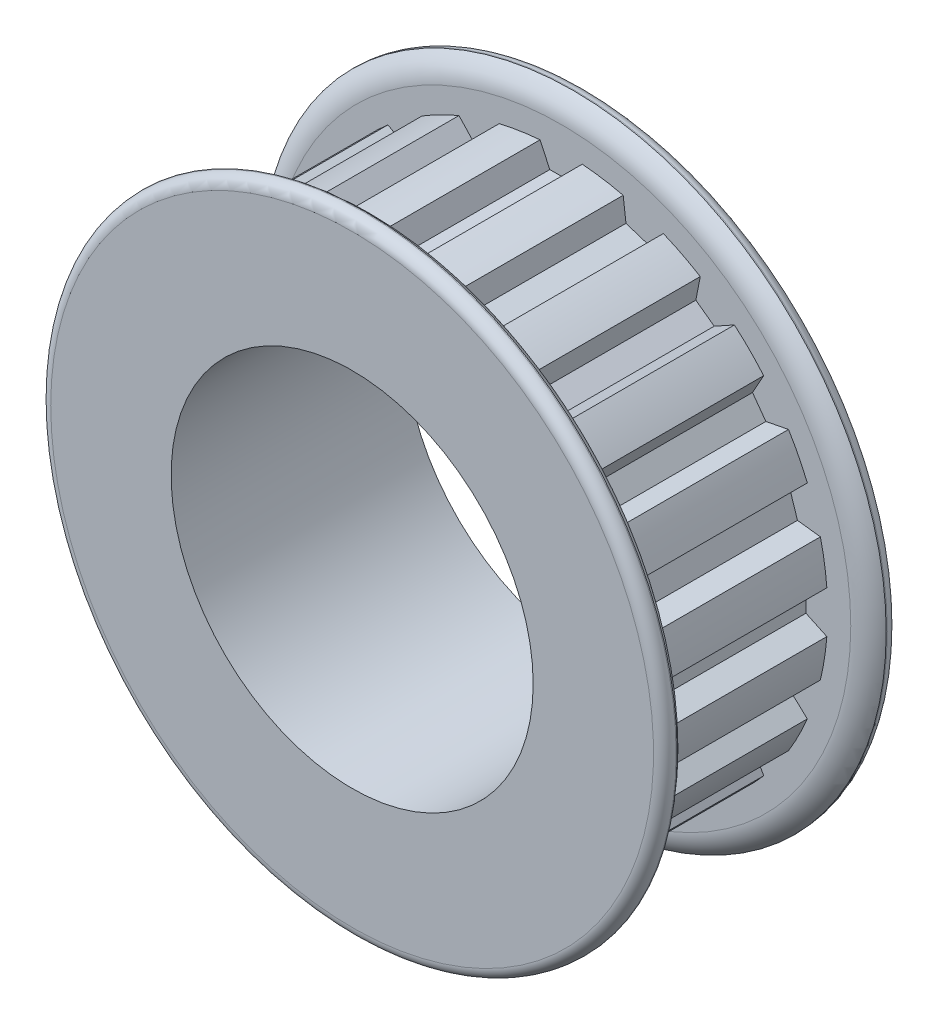
from build123d import *

# Parameters (mm, degrees)
CUT_EXTRUDE1_START     = -9.5
CUT_EXTRUDE1_DEPTH     = 11.2
CIRPATTERN1_COUNT      = 20
SKETCH4_R              = 2
CUT_EXTRUDE2_DEPTH     = 30.034462282
CUT_EXTRUDE3_DEPTH     = 1.5
CIRPATTERN2_COUNT      = 2
CIRPATTERN2_ANGLE      = 90
FILLET1_R              = 0.685714286
FILLET2_R              = 0.24
MOVE_START             = -11
MOVE_FACE1_OUTLINE_R   = 11
MOVE_FACE1_OUTLINE_R_2 = 4
MOVE_FACE1_DEPTH       = 14.2


# Read off the part's stored shape, not the designer's step: Move Face1
with BuildPart() as part:
    # Sketch7 → Revolve1 (revolve)
    with BuildSketch(Plane(origin=(0, 0, 0), x_dir=(0, 0, -1), z_dir=(1, 0, 0)), mode=Mode.PRIVATE) as revolve1_sk:
        with BuildLine():
            Line((-11, 4), (-11, 12))
            Line((-11, 12), (-3.2, 12))
            Line((-3.2, 12), (-3.2, 19))
            Line((-3.2, 19), (-2.45, 19))
            ThreePointArc((-2.45, 19), (-1.899268567, 18.392512657), (-1.7, 17.597127202))
            Line((-1.7, 17.597127202), (-1.7, 16.194254403))
            Line((-1.7, 16.194254403), (9.5, 16.194254403))
            Line((9.5, 16.194254403), (9.5, 17.597127202))
            ThreePointArc((9.5, 17.597127202), (9.699268567, 18.392512657), (10.25, 19))
            Line((10.25, 19), (11, 19))
            Line((11, 19), (11, 4))
            Line((11, 4), (-11, 4))
        make_face()
    revolve(revolve1_sk.sketch.rotate(Axis((0, 0, 11), (0, 0, -1)), 90), axis=Axis((0, 0, 11), (0, 0, -1)))

    # Sketch3 → Cut-Extrude1 (cut)
    with BuildSketch(Plane.XY.offset(CUT_EXTRUDE1_START)):
        with BuildLine():
            Line((-0.690489274, 14.873375), (0.690489274, 14.873375))
            Line((0.690489274, 14.873375), (1.2827, 16.143375))
            ThreePointArc((1.2827, 16.143375), (0, 16.194254403), (-1.2827, 16.143375))
            Line((-1.2827, 16.143375), (-0.690489274, 14.873375))
        make_face()
    cut_extrude1 = extrude(amount=CUT_EXTRUDE1_DEPTH, mode=Mode.SUBTRACT)

    # CirPattern1: Cut-Extrude1 ×20 about axis
    cirpattern1_axis = Axis((0, 0, 0), (0, 0, 1))
    for i in range(1, CIRPATTERN1_COUNT):
        add(cut_extrude1.rotate(cirpattern1_axis, i * 360 / CIRPATTERN1_COUNT), mode=Mode.SUBTRACT)

    # Sketch4 → Cut-Extrude2 (cut, through all)
    with BuildSketch(Plane(origin=(0, 0, 0), x_dir=(1, 0, 0), z_dir=(0, 1, 0))):
        with Locations(Location((0, -7.1, 0), (0, 0, 90))):
            Circle(SKETCH4_R)
    cut_extrude2 = extrude(amount=CUT_EXTRUDE2_DEPTH, mode=Mode.SUBTRACT)

    # Sketch5 → Revolve2 (revolve)
    with BuildSketch(Plane.XY.offset(7.1), mode=Mode.PRIVATE) as revolve2_sk:
        Polygon((0, 11.832159566), (0, 4), (-1.365, 4), (-2, 4.635), (-2, 11.197159566), (-1.365, 11.832159566), align=None)
    revolve2 = revolve(revolve2_sk.sketch.rotate(Axis((0, 0, 7.1), (0, 1, 0)), 270), axis=Axis((0, 0, 7.1), (0, 1, 0)))

    # Sketch6 → Cut-Extrude3 (cut)
    with BuildSketch(Plane(origin=(0, 11.832159566, 0), x_dir=(-1, 0, 0), z_dir=(0, -1, 0))):
        Polygon((0, -5.945299462), (-1, -6.522649731), (-1, -7.677350269), (0, -8.254700538), (1, -7.677350269), (1, -6.522649731), align=None)
    cut_extrude3 = extrude(amount=CUT_EXTRUDE3_DEPTH, mode=Mode.SUBTRACT)

    # CirPattern2: Cut-Extrude2, Revolve2, Cut-Extrude3 ×2 about axis
    cirpattern2_axis = Axis((0, 0, 0), (0, 0, -1))
    add([cut_extrude2.rotate(cirpattern2_axis, i * CIRPATTERN2_ANGLE / (CIRPATTERN2_COUNT - 1)) for i in range(1, CIRPATTERN2_COUNT)], mode=Mode.SUBTRACT)
    add([revolve2.rotate(cirpattern2_axis, i * CIRPATTERN2_ANGLE / (CIRPATTERN2_COUNT - 1)) for i in range(1, CIRPATTERN2_COUNT)])
    add([cut_extrude3.rotate(cirpattern2_axis, i * CIRPATTERN2_ANGLE / (CIRPATTERN2_COUNT - 1)) for i in range(1, CIRPATTERN2_COUNT)], mode=Mode.SUBTRACT)

    # Fillet1
    fillet1_edges = [part.edges().sort_by_distance(p)[0] for p in [
        (-19, 0, -11),
        (-12, 0, 11),
        (-12, 0, 3.2),
        (-19, 0, 3.2),
    ]]
    fillet(fillet1_edges, radius=FILLET1_R)

    # Fillet2
    fillet2_edges = [part.edges().sort_by_distance(p)[0] for p in [
        (-4, 0, -11),
        (-1e-09, 12, 9.100000011),
        (11.832159566, -2, 7.1),
        (-4, 0, 11),
    ]]
    fillet(fillet2_edges, radius=FILLET2_R)

    # Split1
    split(bisect_by=Plane.XY.offset(3.2), keep=Keep.BOTTOM)

    # Move Face1 outline → Move Face1 (cut)
    with BuildSketch(Plane.XY.offset(MOVE_START)):
        Circle(MOVE_FACE1_OUTLINE_R)
        Circle(MOVE_FACE1_OUTLINE_R_2, mode=Mode.SUBTRACT)
    extrude(amount=MOVE_FACE1_DEPTH, mode=Mode.SUBTRACT)


solid = part.part
